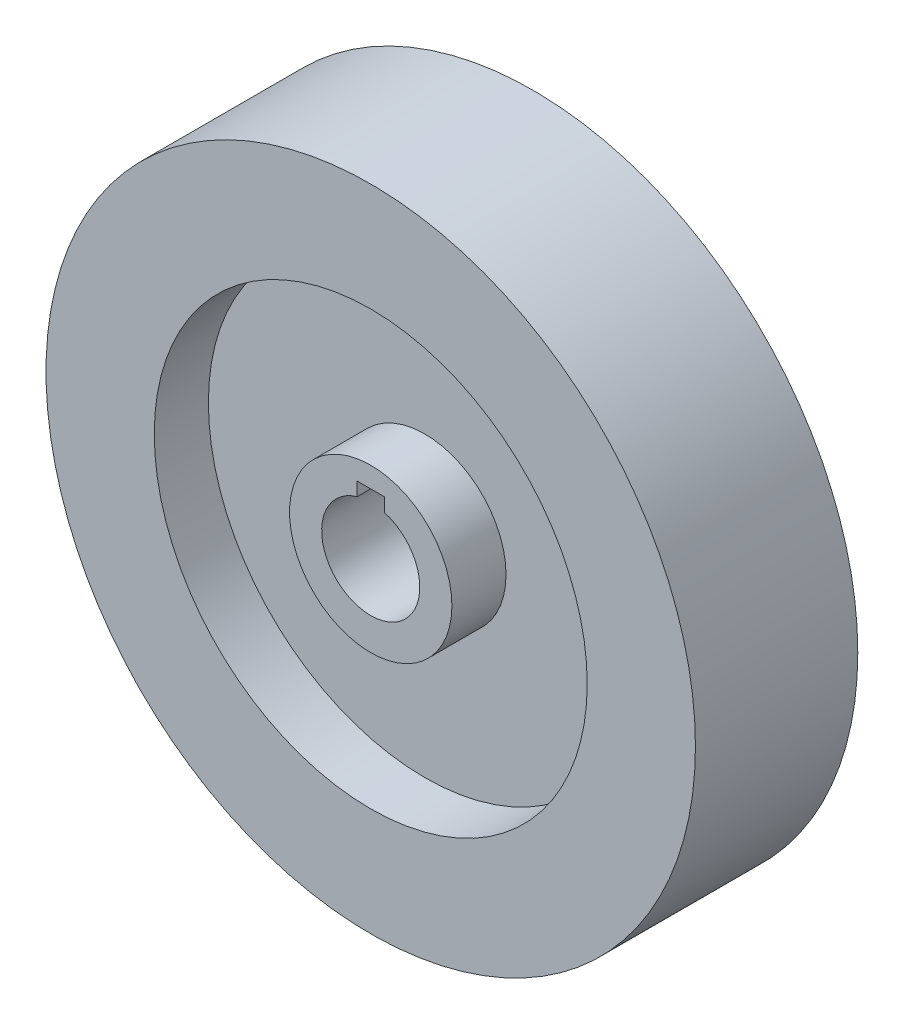
from build123d import *

# Parameters (mm, degrees)
SKETCH4_W          = 6.35
SKETCH4_H          = 3.175
CUT_EXTRUDE1_DEPTH = 115.3


with BuildPart() as part:
    # Sketch1 → Revolve1 (revolve)
    with BuildSketch(Plane(origin=(0, 0, 0), x_dir=(0, 0, -1), z_dir=(1, 0, 0))):
        Polygon((19.05, 11.509375), (-19.05, 11.509375), (-19.05, 19.05), (-6.35, 19.05), (-6.35, 50.8), (-19.05, 50.8), (-19.05, 76.2), (19.05, 76.2), (19.05, 50.8), (6.35, 50.8), (6.35, 19.05), (19.05, 19.05), align=None)
    revolve(axis=Axis((0, 0, 34.214514903), (0, 0, -1)))

    # Sketch4 → Cut-Extrude1 (cut, through all)
    with BuildSketch(Plane(origin=(0, 0, -19.05), x_dir=(-1, 0, 0), z_dir=(0, 0, -1))):
        with Locations((0, 12.650279393)):
            Rectangle(SKETCH4_W, SKETCH4_H)
    extrude(amount=-CUT_EXTRUDE1_DEPTH, mode=Mode.SUBTRACT)


solid = part.part
